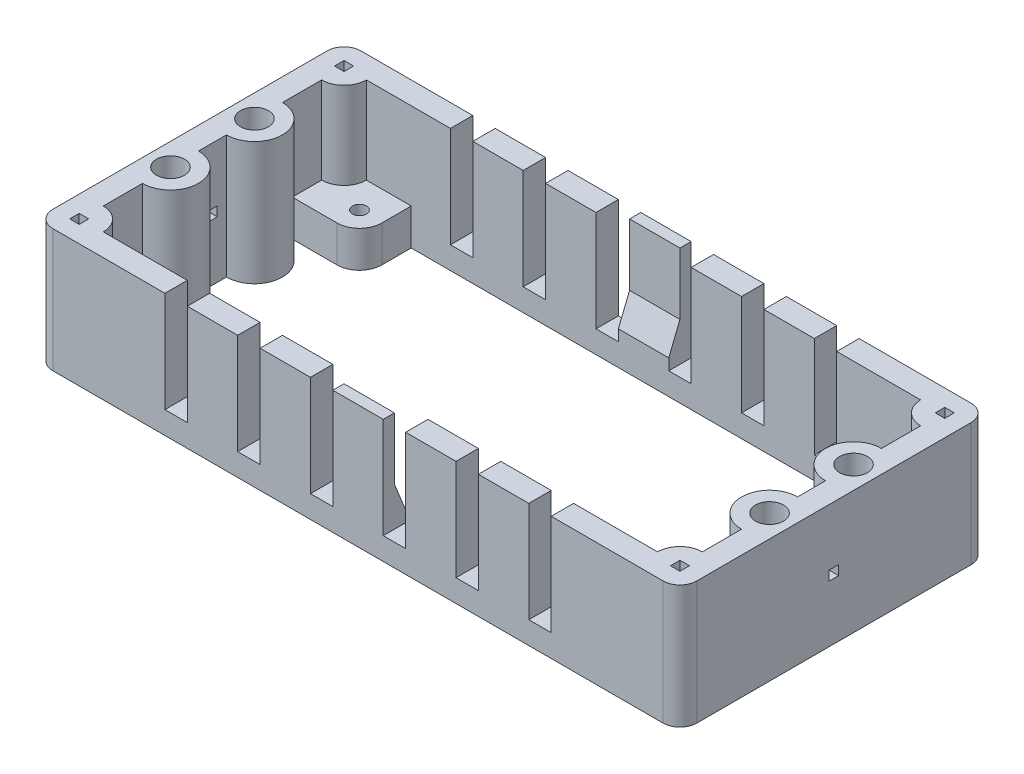
from build123d import *

# Parameters (mm, degrees)
EXTRUDE_1_DEPTH     = 22
SKETCH_4_W          = 12
SKETCH_4_H          = 6.5
EXTRUDE_3_DEPTH     = 9.25
FILLET_1_R          = 4
SKETCH_5_W          = 12
SKETCH_5_H          = 6.5
EXTRUDE_4_DEPTH     = 9.25
FILLET_2_R          = 4
SKETCH_6_R          = 2.5
CUT_EXTRUDE_1_DEPTH = 20
SKETCH_7_R          = 1.25
CUT_EXTRUDE_2_DEPTH = 20
SKETCH_8_R          = 1.25
CUT_EXTRUDE_3_DEPTH = 20
SKETCH_9_W          = 1.7
SKETCH_9_H          = 1.7
CUT_EXTRUDE_4_DEPTH = 120
EXTRUDE_5_DEPTH     = 15.5
SKETCH_11_W         = 1.7
SKETCH_11_H         = 1.7
CUT_EXTRUDE_5_DEPTH = 5
SKETCH_12_W         = 4
SKETCH_12_H         = 18
CUT_EXTRUDE_6_DEPTH = 71
SKETCH_13_W         = 9
SKETCH_13_H         = 2
CUT_EXTRUDE_7_DEPTH = 11
CHAMFER_1_SIZE      = 5
CHAMFER_1_SIZE_2    = 2.020131129


with BuildPart() as part:
    # Эскиз1 → Бобышка-Вытянуть1 (new body)
    with BuildSketch(Plane(origin=(0, 0, 0), x_dir=(1, 0, 0), z_dir=(0, 1, 0))):
        with BuildLine():
            Line((-53.32847827, 30.587656235), (55.67152173, 30.587656235))
            ThreePointArc((55.67152173, 30.587656235), (57.792842073, 29.708976578), (58.67152173, 27.587656235))
            Line((58.67152173, 27.587656235), (58.67152173, -21.412343765))
            ThreePointArc((58.67152173, -21.412343765), (57.792842073, -23.533664109), (55.67152173, -24.412343765))
            Line((55.67152173, -24.412343765), (-53.32847827, -24.412343765))
            ThreePointArc((-53.32847827, -24.412343765), (-55.449798614, -23.533664109), (-56.32847827, -21.412343765))
            Line((-56.32847827, -21.412343765), (-56.32847827, 27.587656235))
            ThreePointArc((-56.32847827, 27.587656235), (-55.449798614, 29.708976578), (-53.32847827, 30.587656235))
        make_face()
        with BuildLine():
            Line((-52.32847827, 26.587656235), (-52.32847827, 15.587656235))
            ThreePointArc((-52.32847827, 15.587656235), (-47.32847827, 10.587656235), (-52.32847827, 5.587656235))
            Line((-52.32847827, 5.587656235), (-52.32847827, 0.587656235))
            ThreePointArc((-52.32847827, 0.587656235), (-47.32847827, -4.412343765), (-52.32847827, -9.412343765))
            Line((-52.32847827, -9.412343765), (-52.32847827, -20.412343765))
            Line((-52.32847827, -20.412343765), (54.67152173, -20.412343765))
            Line((54.67152173, -20.412343765), (54.67152173, -9.412343765))
            ThreePointArc((54.67152173, -9.412343765), (49.67152173, -4.412343765), (54.67152173, 0.587656235))
            Line((54.67152173, 0.587656235), (54.67152173, 5.587656235))
            ThreePointArc((54.67152173, 5.587656235), (49.67152173, 10.587656235), (54.67152173, 15.587656235))
            Line((54.67152173, 15.587656235), (54.67152173, 26.587656235))
            Line((54.67152173, 26.587656235), (-52.32847827, 26.587656235))
        make_face(mode=Mode.SUBTRACT)
    extrude(amount=EXTRUDE_1_DEPTH)

    # Эскиз4 → Бобышка-Вытянуть3 (add)
    with BuildSketch(Plane(origin=(0, 0, 20.412343765), x_dir=(-1, 0, 0), z_dir=(0, 0, -1))):
        with Locations((46.32847827, 3.25)):
            Rectangle(SKETCH_4_W, SKETCH_4_H)
        with Locations((-48.67152173, 3.25)):
            Rectangle(SKETCH_4_W, SKETCH_4_H)
    extrude(amount=EXTRUDE_3_DEPTH)

    # Скругление1
    fillet_1_edges = [part.edges().sort_by_distance(p)[0] for p in [
        (-40.32847827, 3.25, 11.162343765),
        (42.67152173, 3.25, 11.162343765),
    ]]
    fillet(fillet_1_edges, radius=FILLET_1_R)

    # Эскиз5 → Бобышка-Вытянуть4 (add)
    with BuildSketch(Plane.XY.offset(-26.587656235)):
        with Locations((-46.32847827, 3.25)):
            Rectangle(SKETCH_5_W, SKETCH_5_H)
        with Locations((48.67152173, 3.25)):
            Rectangle(SKETCH_5_W, SKETCH_5_H)
    extrude(amount=EXTRUDE_4_DEPTH)

    # Скругление2
    fillet_2_edges = [part.edges().sort_by_distance(p)[0] for p in [
        (-40.32847827, 3.25, -17.337656235),
        (42.67152173, 3.25, -17.337656235),
    ]]
    fillet(fillet_2_edges, radius=FILLET_2_R)

    # Эскиз6 → Вырез-Вытянуть1 (cut)
    with BuildSketch(Plane(origin=(0, 22, 0), x_dir=(1, 0, 0), z_dir=(0, 1, 0))):
        with Locations(Location((-52.32847827, 10.587656235, 0), (0, 0, 270))):
            Circle(SKETCH_6_R)
        with Locations(Location((-52.32847827, -4.412343765, 0), (0, 0, 270))):
            Circle(SKETCH_6_R)
        with Locations(Location((54.67152173, 10.587656235, 0), (0, 0, 270))):
            Circle(SKETCH_6_R)
        with Locations(Location((54.67152173, -4.412343765, 0), (0, 0, 270))):
            Circle(SKETCH_6_R)
    extrude(amount=-CUT_EXTRUDE_1_DEPTH, mode=Mode.SUBTRACT)

    # Эскиз7 → Вырез-Вытянуть2 (cut)
    with BuildSketch(Plane(origin=(0, 6.5, 0), x_dir=(1, 0, 0), z_dir=(0, 1, 0))):
        with Locations(Location((-44.32847827, 21.337656235, 0), (0, 0, 270))):
            Circle(SKETCH_7_R)
        with Locations(Location((46.67152173, 21.337656235, 0), (0, 0, 270))):
            Circle(SKETCH_7_R)
        with Locations(Location((46.67152173, -15.162343765, 0), (0, 0, 270))):
            Circle(SKETCH_7_R)
        with Locations(Location((-44.32847827, -15.162343765, 0), (0, 0, 270))):
            Circle(SKETCH_7_R)
    extrude(amount=-CUT_EXTRUDE_2_DEPTH, mode=Mode.SUBTRACT)

    # Эскиз8 → Вырез-Вытянуть3 (cut)
    with BuildSketch(Plane(origin=(0, 2, 0), x_dir=(1, 0, 0), z_dir=(0, 1, 0))):
        with Locations(Location((-52.32847827, 10.587656235, 0), (0, 0, 270))):
            Circle(SKETCH_8_R)
        with Locations(Location((-52.32847827, -4.412343765, 0), (0, 0, 270))):
            Circle(SKETCH_8_R)
        with Locations(Location((54.67152173, 10.587656235, 0), (0, 0, 270))):
            Circle(SKETCH_8_R)
        with Locations(Location((54.67152173, -4.412343765, 0), (0, 0, 270))):
            Circle(SKETCH_8_R)
    extrude(amount=-CUT_EXTRUDE_3_DEPTH, mode=Mode.SUBTRACT)

    # Эскиз9 → Вырез-Вытянуть4 (cut)
    with BuildSketch(Plane.ZY.offset(56.32847827)):
        with Locations((-3.087656235, 11)):
            Rectangle(SKETCH_9_W, SKETCH_9_H)
    extrude(amount=-CUT_EXTRUDE_4_DEPTH, mode=Mode.SUBTRACT)

    # Эскиз10 → Бобышка-Вытянуть5 (add)
    with BuildSketch(Plane(origin=(0, 6.5, 0), x_dir=(1, 0, 0), z_dir=(0, 1, 0))):
        with BuildLine():
            Line((-52.32847827, 22.587656235), (-52.32847827, 26.587656235))
            Line((-52.32847827, 26.587656235), (-48.32847827, 26.587656235))
            ThreePointArc((-48.32847827, 26.587656235), (-49.500051146, 23.75922911), (-52.32847827, 22.587656235))
        make_face()
        with BuildLine():
            Line((-52.32847827, -16.412343765), (-52.32847827, -20.412343765))
            Line((-52.32847827, -20.412343765), (-48.32847827, -20.412343765))
            ThreePointArc((-48.32847827, -20.412343765), (-49.500051146, -17.58391664), (-52.32847827, -16.412343765))
        make_face()
        with BuildLine():
            Line((54.67152173, -16.412343765), (54.67152173, -20.412343765))
            Line((54.67152173, -20.412343765), (50.67152173, -20.412343765))
            ThreePointArc((50.67152173, -20.412343765), (51.843094605, -17.58391664), (54.67152173, -16.412343765))
        make_face()
        with BuildLine():
            Line((54.67152173, 22.587656235), (54.67152173, 26.587656235))
            Line((54.67152173, 26.587656235), (50.67152173, 26.587656235))
            ThreePointArc((50.67152173, 26.587656235), (51.843094605, 23.75922911), (54.67152173, 22.587656235))
        make_face()
    extrude(amount=EXTRUDE_5_DEPTH)

    # Эскиз11 → Вырез-Вытянуть5 (cut)
    with BuildSketch(Plane(origin=(0, 22, 0), x_dir=(1, 0, 0), z_dir=(0, 1, 0))):
        with Locations((-52.47847827, 26.737656235)):
            Rectangle(SKETCH_11_W, SKETCH_11_H)
        with Locations((54.82152173, 26.737656235)):
            Rectangle(SKETCH_11_W, SKETCH_11_H)
        with Locations((54.82152173, -20.562343765)):
            Rectangle(SKETCH_11_W, SKETCH_11_H)
        with Locations((-52.47847827, -20.562343765)):
            Rectangle(SKETCH_11_W, SKETCH_11_H)
    extrude(amount=-CUT_EXTRUDE_5_DEPTH, mode=Mode.SUBTRACT)

    # Эскиз12 → Вырез-Вытянуть6 (cut)
    with BuildSketch(Plane.XY.offset(24.412343765)):
        with Locations((-31.32847827, 13)):
            Rectangle(SKETCH_12_W, SKETCH_12_H)
        with Locations((-18.32847827, 13)):
            Rectangle(SKETCH_12_W, SKETCH_12_H)
        with Locations((-5.32847827, 13)):
            Rectangle(SKETCH_12_W, SKETCH_12_H)
        with Locations((7.67152173, 13)):
            Rectangle(SKETCH_12_W, SKETCH_12_H)
        with Locations((20.67152173, 13)):
            Rectangle(SKETCH_12_W, SKETCH_12_H)
        with Locations((33.67152173, 13)):
            Rectangle(SKETCH_12_W, SKETCH_12_H)
    extrude(amount=-CUT_EXTRUDE_6_DEPTH, mode=Mode.SUBTRACT)

    # Эскиз13 → Вырез-Вытянуть7 (cut)
    with BuildSketch(Plane(origin=(0, 22, 0), x_dir=(1, 0, 0), z_dir=(0, 1, 0))):
        with Locations((1.17152173, 27.587656235)):
            Rectangle(SKETCH_13_W, SKETCH_13_H)
        with Locations((1.17152173, -21.412343765)):
            Rectangle(SKETCH_13_W, SKETCH_13_H)
    extrude(amount=-CUT_EXTRUDE_7_DEPTH, mode=Mode.SUBTRACT)

    # Фаска1
    # the kernel refuses this chamfer: 5, 2.020131129 mm, written as the material it takes off along each edge
    with BuildSketch(Plane(origin=(5.67152173, 11, -26.587656235), x_dir=(0, -0.9998956380575358, 0.01444690255776391), z_dir=(-1, 0, 0))) as chamfer_1_piece_1_section:
        Polygon((CHAMFER_1_SIZE * 0.999895638058, -CHAMFER_1_SIZE * 0.0144469025578), (-CHAMFER_1_SIZE_2 * 0.014446902559, -CHAMFER_1_SIZE_2 * 0.999895638145), (0, 0), align=None)
    chamfer_1_piece_1 = extrude(amount=21.964944974, mode=Mode.PRIVATE)
    chamfer_1_piece_1 = split(chamfer_1_piece_1, bisect_by=Plane(origin=(-7.32847827, 9.333169456, -27.260900856), z_dir=(1, 0, 0)), keep=Keep.TOP, mode=Mode.PRIVATE)
    chamfer_1_piece_1 = split(chamfer_1_piece_1, bisect_by=Plane(origin=(1.17152173, 9.333169456, -28.587656235), z_dir=(0, 0, 1)), keep=Keep.TOP, mode=Mode.PRIVATE)
    add(chamfer_1_piece_1, mode=Mode.SUBTRACT)
    with BuildSketch(Plane(origin=(18.636466704, 11, 20.412343765), x_dir=(0, -0.9998956380575358, -0.01444690255776391), z_dir=(-1, 0, 0))) as chamfer_1_piece_2_section:
        Polygon((CHAMFER_1_SIZE * 0.999895638058, CHAMFER_1_SIZE * 0.0144469025578), (-CHAMFER_1_SIZE_2 * 0.014446902559, CHAMFER_1_SIZE_2 * 0.999895638145), (0, 0), align=None)
    chamfer_1_piece_2 = extrude(amount=21.964944974, mode=Mode.PRIVATE)
    chamfer_1_piece_2 = split(chamfer_1_piece_2, bisect_by=Plane(origin=(9.67152173, 9.333169456, 21.085588387), z_dir=(-1, 0, 0)), keep=Keep.TOP, mode=Mode.PRIVATE)
    chamfer_1_piece_2 = split(chamfer_1_piece_2, bisect_by=Plane(origin=(1.17152173, 9.333169456, 22.412343765), z_dir=(0, 0, -1)), keep=Keep.TOP, mode=Mode.PRIVATE)
    add(chamfer_1_piece_2, mode=Mode.SUBTRACT)


solid = part.part
